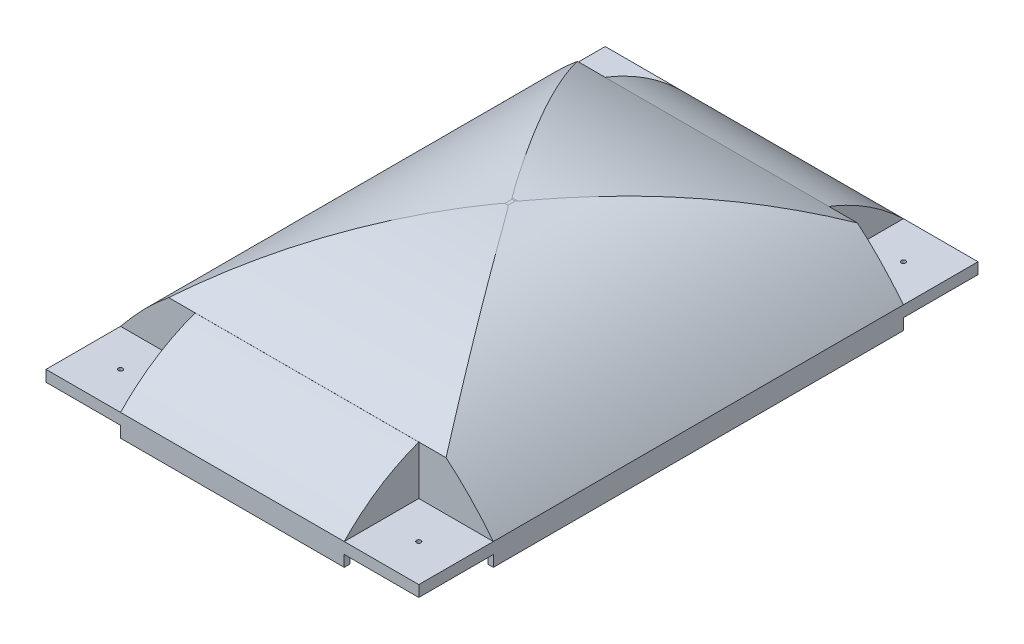
from build123d import *

# Parameters (mm, degrees)
CROQUIS1_W                = 100
CROQUIS1_H                = 150
SALIENTE_EXTRUIR1_DEPTH   = 30
CROQUIS3_W                = 1.5
CROQUIS3_H                = 110
CROQUIS3_W_2              = 60
CROQUIS3_H_2              = 1.5
SALIENTE_EXTRUIR2_DEPTH   = 3
CROQUIS5_W                = 20
CROQUIS5_H                = 20
CORTAR_EXTRUIR2_DEPTH     = 27
CROQUIS6_R                = 0.6
CORTAR_EXTRUIR3_DEPTH     = 95.09569597
SIMETR_A2_COPY_1_SKETCH_R = 0.6
SIMETR_A2_COPY_1_DEPTH    = 95.09569597
CORTAR_EXTRUIR4_DEPTH     = 129.549601322
CORTAR_EXTRUIR5_START     = -150
CORTAR_EXTRUIR5_DEPTH     = 150
CORTAR_EXTRUIR6_DEPTH     = 114.688170172
CORTAR_EXTRUIR7_DEPTH     = 114.688170172


# Read off the part's stored shape, not the designer's step: Cortar-Extruir5
with BuildPart() as part:
    # Croquis1 → Saliente-Extruir1 (new body)
    with BuildSketch(Plane(origin=(0, 0, 0), x_dir=(1, 0, 0), z_dir=(0, 1, 0))):
        Rectangle(CROQUIS1_W, CROQUIS1_H)
    extrude(amount=SALIENTE_EXTRUIR1_DEPTH)

    # Croquis3 → Saliente-Extruir2 (add)
    with BuildSketch(Plane.XZ):
        with Locations((-49.25, 0)):
            Rectangle(CROQUIS3_W, CROQUIS3_H)
        with Locations((0, -74.25)):
            Rectangle(CROQUIS3_W_2, CROQUIS3_H_2)
        with Locations((49.25, 0)):
            Rectangle(CROQUIS3_W, CROQUIS3_H)
        with Locations((0, 74.25)):
            Rectangle(CROQUIS3_W_2, CROQUIS3_H_2)
    extrude(amount=SALIENTE_EXTRUIR2_DEPTH)

    # Croquis5 → Cortar-Extruir2 (cut)
    with BuildSketch(Plane(origin=(0, 30, 0), x_dir=(1, 0, 0), z_dir=(0, 1, 0))):
        with Locations((-40, 65)):
            Rectangle(CROQUIS5_W, CROQUIS5_H)
        with Locations((40, 65)):
            Rectangle(CROQUIS5_W, CROQUIS5_H)
        with Locations((40, -65)):
            Rectangle(CROQUIS5_W, CROQUIS5_H)
        with Locations((-40, -65)):
            Rectangle(CROQUIS5_W, CROQUIS5_H)
    extrude(amount=-CORTAR_EXTRUIR2_DEPTH, mode=Mode.SUBTRACT)

    # Croquis6 → Cortar-Extruir3 (cut, through all)
    with BuildSketch(Plane(origin=(0, 3, 0), x_dir=(1, 0, 0), z_dir=(0, 1, 0))):
        with Locations(Location((40, 65, 0), (0, 0, 270))):
            Circle(CROQUIS6_R)
    cortar_extruir3 = extrude(amount=-CORTAR_EXTRUIR3_DEPTH, mode=Mode.SUBTRACT)

    # Simetría1: Cortar-Extruir3 across plane
    add(cortar_extruir3.mirror(Plane.XY), mode=Mode.SUBTRACT)

    # Simetría2: Cortar-Extruir3 across plane
    add(cortar_extruir3.mirror(Plane(origin=(0, 0, 0), x_dir=(0, 0, 1), z_dir=(1, 0, 0))), mode=Mode.SUBTRACT)

    # Simetría2 copy 1 sketch → Simetría2 copy 1 (cut, through all)
    with BuildSketch(Plane(origin=(0, 3, 0), x_dir=(-1, 0, 0), z_dir=(0, 1, 0))):
        with Locations(Location((40, 65, 0), (0, 0, 270))):
            Circle(SIMETR_A2_COPY_1_SKETCH_R)
    extrude(amount=-SIMETR_A2_COPY_1_DEPTH, mode=Mode.SUBTRACT)

    # Croquis7 → Cortar-Extruir4 (cut, through all)
    with BuildSketch(Plane.ZY.offset(50)):
        with BuildLine():
            Line((-55, 30), (-55, 15.839120061))
            add(Edge.make_bspline(
                [(-55, 15.839120061), (-28.872240535, 29.681618902), (-0.383648773, 29.996375418)],
                knots=[0.272557177, 0.272557177, 0.272557177, 0.972153635, 0.972153635, 0.972153635], degree=2))
            add(Edge.make_bspline(
                [(-0.015370594, 30), (-0.199457484, 29.998481088), (-0.383648773, 29.996375418)],
                knots=[0.9954153, 0.9954153, 0.9954153, 1, 1, 1], degree=2))
            Line((-0.015370594, 30), (-55, 30))
        make_face()
        with BuildLine():
            Line((55, 30), (1.887981045, 30))
            add(Edge.make_bspline(
                [(55, 16.129627481), (29.637077968, 29.770366226), (1.887981045, 30)],
                knots=[0.278550096, 0.278550096, 0.278550096, 0.971678885, 0.971678885, 0.971678885], degree=2))
            Line((55, 16.129627481), (55, 30))
        make_face()
    extrude(amount=-CORTAR_EXTRUIR4_DEPTH, mode=Mode.SUBTRACT)

    # Cortar-Extruir5 outline → Cortar-Extruir5 (cut)
    with BuildSketch(Plane.XY.offset(75).offset(CORTAR_EXTRUIR5_START)):
        with BuildLine():
            Line((7.5e-08, 30.000000001), (-50, 30))
            Line((-50, 30), (-50, 3))
            add(Edge.make_bspline(
                [(-50, 3), (-28.36157969, 29.799939616), (7.5e-08, 30.000000001)],
                knots=[0, 0, 0, 0.985180711, 0.985180711, 0.985180711], degree=2))
        make_face()
        with BuildLine():
            Line((50, 3), (50, 30))
            Line((50, 30), (0.854762637, 30))
            add(Edge.make_bspline(
                [(0.854762637, 30), (28.715142785, 29.789747772), (50, 3)],
                knots=[0.41802479, 0.41802479, 0.41802479, 1.368246178, 1.368246178, 1.368246178], degree=2))
        make_face()
    extrude(amount=CORTAR_EXTRUIR5_DEPTH, mode=Mode.SUBTRACT)

    # Croquis10 → Cortar-Extruir6 (cut, through all)
    with BuildSketch(Plane.ZY.offset(30)):
        with BuildLine():
            Line((75, 3), (75, 42.786726144))
            Line((75, 42.786726144), (55, 42.786726144))
            Line((55, 42.786726144), (55, 16.107425877))
            add(Edge.make_bspline(
                [(75, 3), (66.353698685, 12.015089749), (55, 16.107425877)],
                knots=[0, 0, 0, 1, 1, 1], degree=2))
        make_face()
    extrude(amount=-CORTAR_EXTRUIR6_DEPTH, mode=Mode.SUBTRACT)

    # Croquis11 → Cortar-Extruir7 (cut, through all)
    with BuildSketch(Plane.ZY.offset(30)):
        with BuildLine():
            Line((-75, 3), (-75, 36.400642598))
            Line((-75, 36.400642598), (-55, 36.400642598))
            Line((-55, 36.400642598), (-55, 15.839120066))
            add(Edge.make_bspline(
                [(-75, 3), (-66.12999018, 11.527113216), (-55, 15.839120066)],
                knots=[0, 0, 0, 1, 1, 1], degree=2))
        make_face()
    extrude(amount=-CORTAR_EXTRUIR7_DEPTH, mode=Mode.SUBTRACT)


solid = part.part
